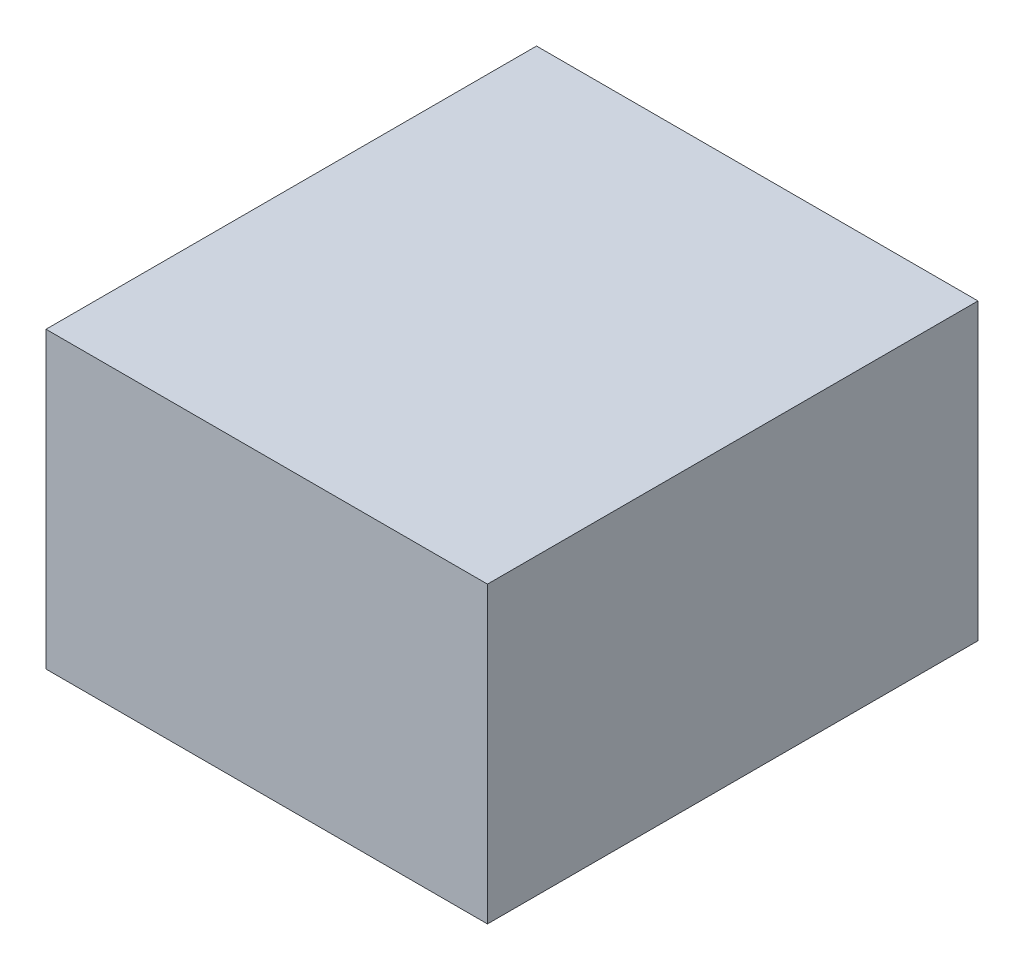
from build123d import *

# Parameters (mm, degrees)
SKETCH1_W           = 914.4
SKETCH1_H           = 1016
BOSS_EXTRUDE1_DEPTH = 304.8


with BuildPart() as part:
    # Sketch1 → Boss-Extrude1 (new, symmetric)
    with BuildSketch(Plane(origin=(0, 0, 0), x_dir=(1, 0, 0), z_dir=(0, 1, 0))):
        Rectangle(SKETCH1_W, SKETCH1_H)
    extrude(amount=BOSS_EXTRUDE1_DEPTH, both=True)


solid = part.part
